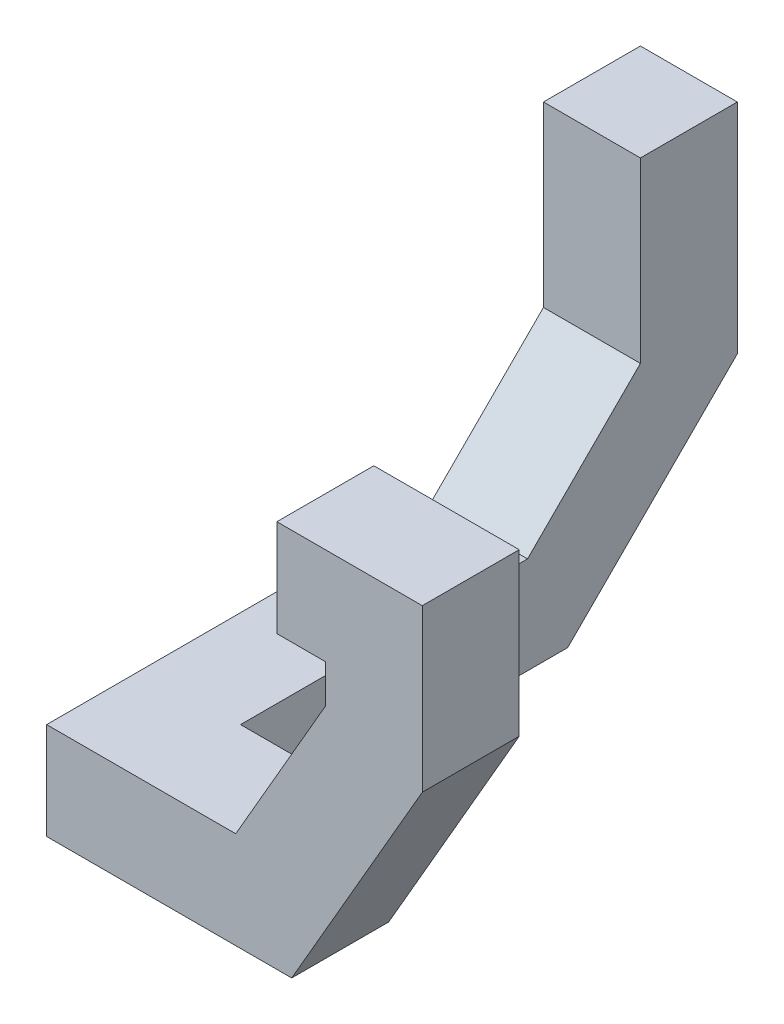
from build123d import *

# Parameters (mm, degrees)
BOSS_EXTRUDE1_DEPTH      = 4
BOSS_EXTRUDE1_DEPTH_BACK = 4
BOSS_EXTRUDE2_DEPTH      = 4
BOSS_EXTRUDE2_DEPTH_BACK = 4


with BuildPart() as part:
    # Sketch1 → Boss-Extrude1 (new, two sides: drawn at the far end of the back side and taken through both)
    with BuildSketch(Plane(origin=(0, 0, 0), x_dir=(0, 0, -1), z_dir=(1, 0, 0)).offset(-BOSS_EXTRUDE1_DEPTH_BACK)):
        Polygon((-8, 4), (0, 4), (0, -14), (-14, -28), (-45, -28), (-45, -20), (-17.313708499, -20), (-8, -10.686291501), align=None)
    extrude(amount=BOSS_EXTRUDE1_DEPTH + BOSS_EXTRUDE1_DEPTH_BACK)

    # Sketch2 → Boss-Extrude2 (add, two sides: drawn at the far end of the back side and taken through both)
    with BuildSketch(Plane.XY.offset(45).offset(-BOSS_EXTRUDE2_DEPTH_BACK)):
        Polygon((5, -20), (11.603992822, -20), (19, -7.189739794), (19, -4), (15, -4), (15, 4), (27, 4), (27, -9.333333333), (16.222794975, -28), (5, -28), (-4, -28), (-4, -20), align=None)
    extrude(amount=BOSS_EXTRUDE2_DEPTH + BOSS_EXTRUDE2_DEPTH_BACK)


solid = part.part
